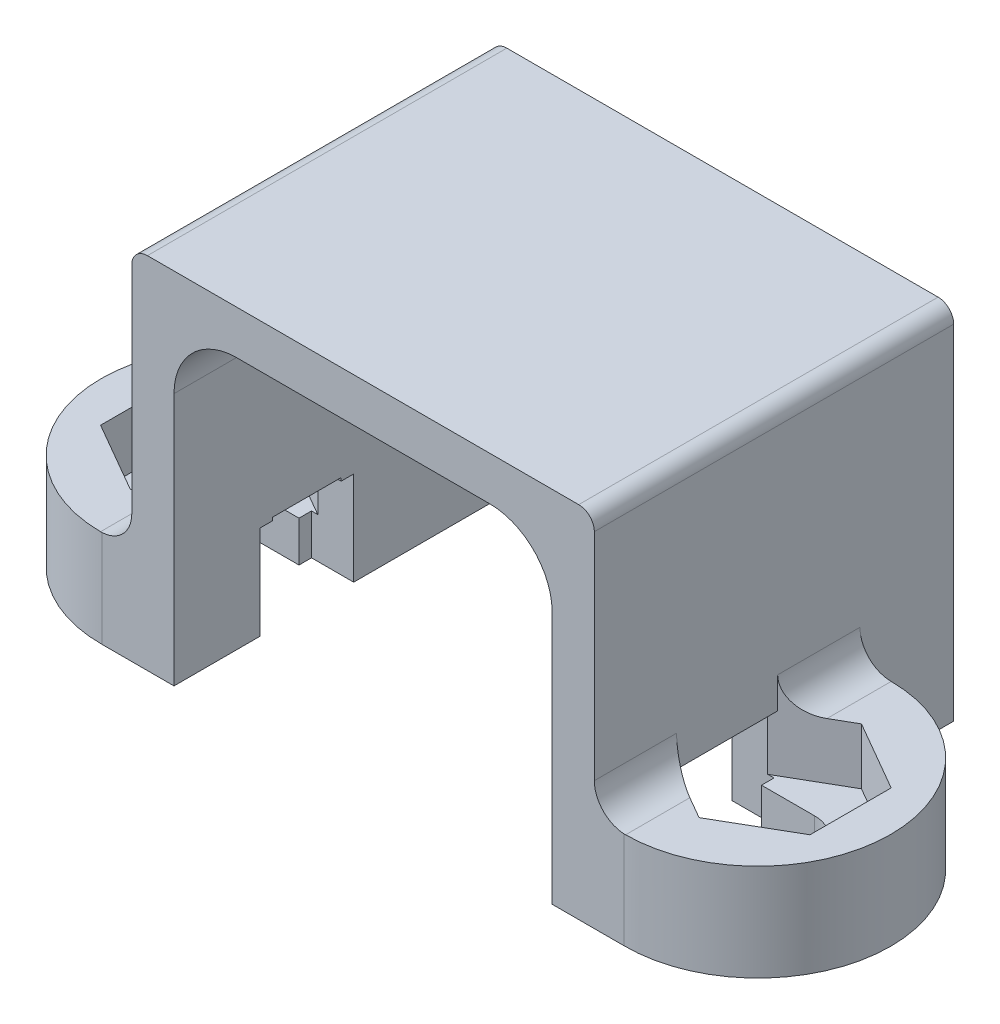
from build123d import *

# Parameters (mm, degrees)
SKETCH1_W           = 7.4
SKETCH1_H           = 11.5
BOSS_EXTRUDE1_DEPTH = 11.5
BOSS_EXTRUDE2_DEPTH = 3.1
SKETCH6_W           = 6.05
SKETCH6_H           = 10.1
CUT_EXTRUDE1_DEPTH  = 21.593612692
CUT_EXTRUDE2_DEPTH  = 3.1
SKETCH8_W           = 3
SKETCH8_H           = 3
CUT_EXTRUDE3_DEPTH  = 1.35
CUT_EXTRUDE4_DEPTH  = 1.8
FILLET1_R           = 1
FILLET2_R           = 0.5
FILLET3_R           = 2


# Read off the part's stored shape, not the designer's step: Mirror3
with BuildPart() as part:
    # Sketch1 → Boss-Extrude1 (new body)
    with BuildSketch(Plane(origin=(0, 0, 0), x_dir=(1, 0, 0), z_dir=(0, 1, 0))):
        with Locations((-3.7, 0)):
            Rectangle(SKETCH1_W, SKETCH1_H)
    extrude(amount=BOSS_EXTRUDE1_DEPTH)

    # Sketch3 → Boss-Extrude2 (add)
    with BuildSketch(Plane(origin=(0, 0, 0), x_dir=(1, 0, 0), z_dir=(0, 1, 0))):
        with BuildLine():
            Line((-8.35, 2.749742999), (-7.4, 2.749742999))
            Line((-7.4, 2.749742999), (-7.4, -5.75))
            Line((-7.4, -5.75), (-8.35, -5.75))
            ThreePointArc((-8.35, -5.75), (-12.633049046, -1.500128501), (-8.35, 2.749742999))
        make_face()
    extrude(amount=BOSS_EXTRUDE2_DEPTH)

    # Sketch6 → Cut-Extrude1 (cut, through all)
    with BuildSketch(Plane(origin=(0, 0, -5.75), x_dir=(-1, 0, 0), z_dir=(0, 0, -1))):
        with Locations((3.025, 5.05)):
            Rectangle(SKETCH6_W, SKETCH6_H)
    extrude(amount=-CUT_EXTRUDE1_DEPTH, mode=Mode.SUBTRACT)

    # Sketch7 → Cut-Extrude2 (cut)
    with BuildSketch(Plane.XZ):
        with BuildLine():
            Line((-9.1, 2.600128501), (-6.05, 2.600128501))
            ThreePointArc((-6.05, 2.600128501), (-4.95, 1.500128501), (-6.05, 0.400128501))
            Line((-6.05, 0.400128501), (-9.1, 0.400128501))
            ThreePointArc((-9.1, 0.400128501), (-10.2, 1.500128501), (-9.1, 2.600128501))
        make_face()
    extrude(amount=-CUT_EXTRUDE2_DEPTH, mode=Mode.SUBTRACT)

    # Sketch8 → Cut-Extrude3 (cut)
    with BuildSketch(Plane(origin=(-6.05, 0, 0), x_dir=(0, 0, -1), z_dir=(1, 0, 0))):
        with Locations((-1.500128501, 1.5)):
            Rectangle(SKETCH8_W, SKETCH8_H)
    extrude(amount=-CUT_EXTRUDE3_DEPTH, mode=Mode.SUBTRACT)

    # Sketch9 → Cut-Extrude4 (cut)
    with BuildSketch(Plane(origin=(0, 3.1, 0), x_dir=(1, 0, 0), z_dir=(0, 1, 0))):
        Polygon((-6.85, -2.799166606), (-6.85, -0.201090395), (-9.1, 1.097947711), (-11.35, -0.201090395), (-11.35, -2.799166606), (-9.1, -4.098204712), align=None)
    extrude(amount=-CUT_EXTRUDE4_DEPTH, mode=Mode.SUBTRACT)

    # Fillet1
    # the kernel refuses this fillet: 1 mm, written as the material it adds along each edge
    with BuildSketch(Plane(origin=(-7.4, 3.1, -2.749742999), x_dir=(-1, 0, 0), z_dir=(0, 0, 1))) as fillet1_piece_1_section:
        with BuildLine():
            CenterArc((FILLET1_R, -FILLET1_R), FILLET1_R, 90, 90)
            Line((0, -FILLET1_R), (0, 0))
            Line((0, 0), (FILLET1_R, 0))
        make_face()
    fillet1_piece_1 = extrude(amount=5.133290746, mode=Mode.PRIVATE)
    fillet1_piece_1 = split(fillet1_piece_1, bisect_by=Plane(origin=(-8.63172693, 3.371201356, -0.827590128), z_dir=(0.49999999999999983, 0, -0.8660254037844388)), keep=Keep.TOP, mode=Mode.PRIVATE)
    add(fillet1_piece_1)
    with BuildSketch(Plane(origin=(-7.4, 3.1, -5.249742999), x_dir=(-1, 0, 0), z_dir=(0, 0, 1))) as fillet1_piece_2_section:
        with BuildLine():
            CenterArc((FILLET1_R, -FILLET1_R), FILLET1_R, 90, 90)
            Line((0, -FILLET1_R), (0, 0))
            Line((0, 0), (FILLET1_R, 0))
        make_face()
    fillet1_piece_2 = extrude(amount=7.633290746, mode=Mode.PRIVATE)
    fillet1_piece_2 = fillet1_piece_2 & Plane(origin=(-8.383049046, 3.100281112, 1.500128501), x_dir=(0.007776246012108559, 0, 0.9999697645418881), z_dir=(0, -1, 0)) * Cylinder(4.25, 20, mode=Mode.PRIVATE)
    fillet1_piece_2 = split(fillet1_piece_2, bisect_by=Plane(origin=(-9.26614006, 3.100281112, -1.193868719), z_dir=(0.49999999999999983, 0, -0.8660254037844388)), keep=Keep.TOP, mode=Mode.PRIVATE)
    add(fillet1_piece_2)
    with BuildSketch(Plane(origin=(-7.4, 3.1, 0.616709254), x_dir=(-1, 0, 0), z_dir=(0, 0, 1))) as fillet1_piece_3_section:
        with BuildLine():
            CenterArc((FILLET1_R, -FILLET1_R), FILLET1_R, 90, 90)
            Line((0, -FILLET1_R), (0, 0))
            Line((0, 0), (FILLET1_R, 0))
        make_face()
    fillet1_piece_3 = extrude(amount=5.133290746, mode=Mode.PRIVATE)
    fillet1_piece_3 = split(fillet1_piece_3, bisect_by=Plane(origin=(-8.144343012, 3.326849972, 3.546455893), z_dir=(0.5000000000000008, 0, 0.8660254037844383)), keep=Keep.TOP, mode=Mode.PRIVATE)
    add(fillet1_piece_3)
    with BuildSketch(Plane(origin=(-7.4, 3.1, 0.616709254), x_dir=(-1, 0, 0), z_dir=(0, 0, 1))) as fillet1_piece_4_section:
        with BuildLine():
            CenterArc((FILLET1_R, -FILLET1_R), FILLET1_R, 90, 90)
            Line((0, -FILLET1_R), (0, 0))
            Line((0, 0), (FILLET1_R, 0))
        make_face()
    fillet1_piece_4 = extrude(amount=7.633290746, mode=Mode.PRIVATE)
    fillet1_piece_4 = fillet1_piece_4 & Plane(origin=(-8.383049046, 3.100281111, 1.500128501), x_dir=(0.007776246012108559, 0, 0.9999697645418881), z_dir=(0, -1, 0)) * Cylinder(4.25, 20, mode=Mode.PRIVATE)
    fillet1_piece_4 = split(fillet1_piece_4, bisect_by=Plane(origin=(-9.266139995, 3.100281111, 4.194125683), z_dir=(0.5000000000000008, 0, 0.8660254037844383)), keep=Keep.TOP, mode=Mode.PRIVATE)
    add(fillet1_piece_4)

    # Fillet2
    fillet2_edges = [part.edges().sort_by_distance(p)[0] for p in [
        (-7.4, 11.5, 0),
    ]]
    fillet(fillet2_edges, radius=FILLET2_R)

    # Fillet3
    fillet3_edges = [part.edges().sort_by_distance(p)[0] for p in [
        (-6.05, 10.1, 0),
    ]]
    fillet(fillet3_edges, radius=FILLET3_R)

    # Mirror3: part across plane


with BuildPart() as part_1:
    add(part.part)
    add(part.part.mirror(Plane(origin=(0, 0, 0), x_dir=(0, 0, 1), z_dir=(1, 0, 0))))


solid = part_1.part
